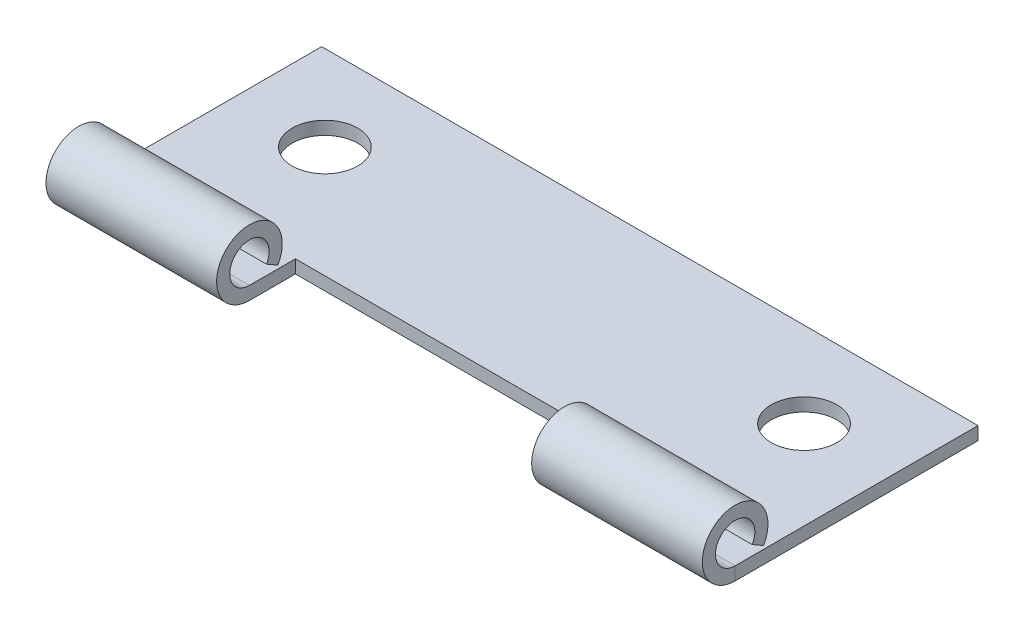
from build123d import *

# Parameters (mm, degrees)
SKETCH2_W               = 50
SKETCH2_H               = 21
BASE_FLANGE1_DEPTH      = 1
HEM1_START              = -25
HEM1_DEPTH              = 50
HEM1_2_DEPTH            = 50
CUT_EXTRUDE1_DEPTH      = 28.408940147
CUT_EXTRUDE1_DEPTH_BACK = 28.408940147
SKETCH5_W               = 24
SKETCH5_H               = 6
SKETCH6_R               = 2.5
CUT_EXTRUDE2_DEPTH      = 28.572631358


# Read off the part's stored shape, not the designer's step: Hem1
# Sheet-metal steps are written as plain solids
with BuildPart() as part:
    # Sketch2 → Base-Flange1 (new body)
    with BuildSketch(Plane(origin=(0, 0, 0), x_dir=(1, 0, 0), z_dir=(0, 1, 0))):
        Rectangle(SKETCH2_W, SKETCH2_H)
    extrude(amount=-BASE_FLANGE1_DEPTH)

    # Hem1 outline → Hem1 (cut)
    with BuildSketch(Plane.YZ.offset(HEM1_START)):
        with BuildLine():
            ThreePointArc((-1, 8), (-0.736067978, 9.118033989), (0, 10))
            Line((0, 10), (0, 10.5))
            Line((0, 10.5), (-1, 10.5))
            Line((-1, 10.5), (-1, 8))
        make_face()
    extrude(amount=HEM1_DEPTH, mode=Mode.SUBTRACT)

    # Hem1 2 outline → Hem1 2 (add)
    with BuildSketch(Plane.YZ.offset(HEM1_START)):
        with BuildLine():
            Line((0.75, 6.700961894), (0.25, 5.834936491))
            ThreePointArc((0.25, 5.834936491), (3.995508667, 8.149788152), (0, 10))
            Line((0, 10), (0, 8))
            ThreePointArc((0, 8), (2.799038106, 8.75), (0.75, 6.700961894))
        make_face()
    extrude(amount=HEM1_2_DEPTH)

    # Sketch5 → Cut-Extrude1 (cut, two sides: drawn at the far end of the back side and taken through both)
    with BuildSketch(Plane(origin=(0, 0, 0), x_dir=(1, 0, 0), z_dir=(0, 1, 0)).offset(-CUT_EXTRUDE1_DEPTH_BACK)):
        with Locations((0, -7.5)):
            Rectangle(SKETCH5_W, SKETCH5_H)
    extrude(amount=CUT_EXTRUDE1_DEPTH + CUT_EXTRUDE1_DEPTH_BACK, mode=Mode.SUBTRACT)

    # Sketch6 → Cut-Extrude2 (cut, through all)
    with BuildSketch(Plane.XZ.offset(1)):
        with Locations(Location((18.25, -4, 0), (0, 0, 270))):
            Circle(SKETCH6_R)
        with Locations(Location((-18.25, -4, 0), (0, 0, 270))):
            Circle(SKETCH6_R)
    extrude(amount=-CUT_EXTRUDE2_DEPTH, mode=Mode.SUBTRACT)


solid = part.part
